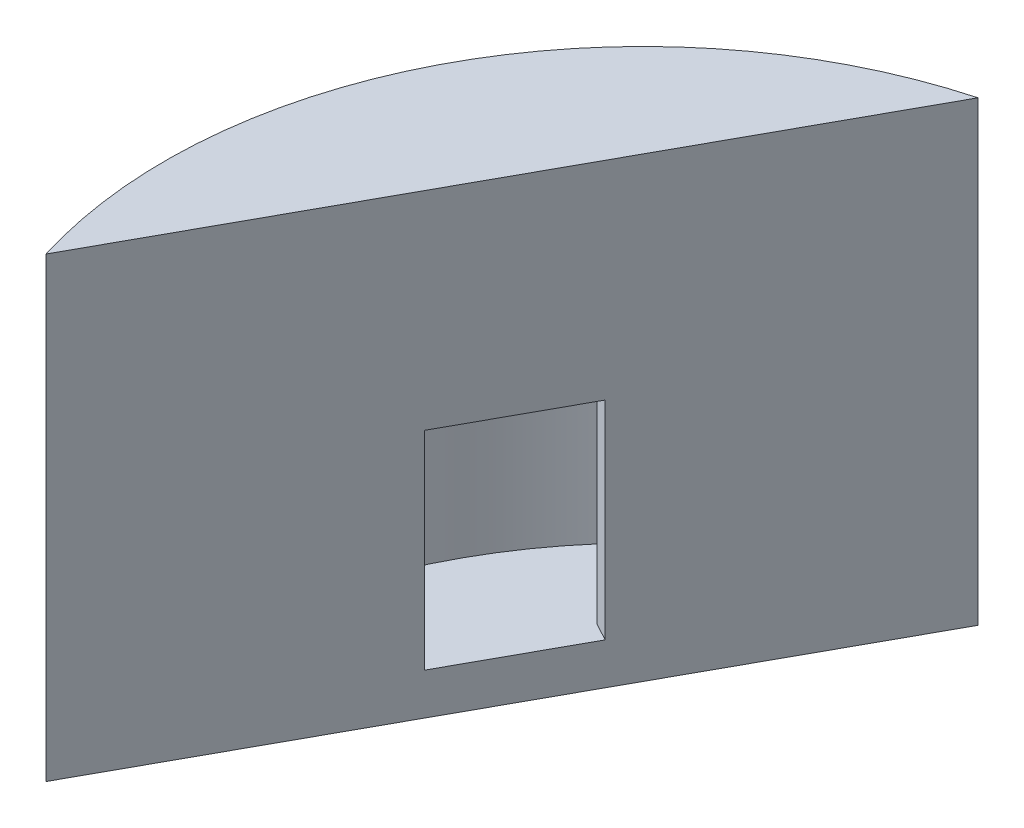
from build123d import *

# Parameters (mm, degrees)
SKETCH1_R           = 73.025
SKETCH1_R_2         = 69.85
BOSS_EXTRUDE1_DEPTH = 63.5
BOSS_EXTRUDE2_START = 6.35
SKETCH2_R           = 73.025
BOSS_EXTRUDE2_DEPTH = 6.35
BOSS_EXTRUDE3_DEPTH = 63.5
CUT_EXTRUDE2_START  = -63.5
CUT_EXTRUDE2_DEPTH  = 57.15
CUT_EXTRUDE4_START  = 19.05
SKETCH6_W           = 20.32
SKETCH6_H           = 31.75
CUT_EXTRUDE4_DEPTH  = 31.75
CUT_EXTRUDE5_DEPTH  = 1016


with BuildPart() as part:
    # Sketch1 → Boss-Extrude1 (new body)
    with BuildSketch(Plane(origin=(0, 0, 0), x_dir=(1, 0, 0), z_dir=(0, 1, 0))):
        Circle(SKETCH1_R)
        Circle(SKETCH1_R_2, mode=Mode.SUBTRACT)
    extrude(amount=BOSS_EXTRUDE1_DEPTH)

    # Sketch2 → Boss-Extrude2 (add)
    with BuildSketch(Plane.XZ.offset(BOSS_EXTRUDE2_START)):
        Circle(SKETCH2_R)
    extrude(amount=-BOSS_EXTRUDE2_DEPTH)

    # Sketch3 → Boss-Extrude3 (add)
    with BuildSketch(Plane(origin=(0, 0, 0), x_dir=(1, 0, 0), z_dir=(0, 1, 0))):
        with BuildLine():
            Line((-67.615293174, -17.526968618), (-21.409243237, 66.488095205))
            ThreePointArc((-21.409243237, 66.488095205), (-61.204368783, 33.660774529), (-67.615293174, -17.526968618))
        make_face()
    extrude(amount=BOSS_EXTRUDE3_DEPTH)

    # Sketch4 → Cut-Extrude2 (cut)
    with BuildSketch(Plane(origin=(0, 63.5, 0), x_dir=(1, 0, 0), z_dir=(0, 1, 0)).offset(CUT_EXTRUDE2_START)):
        with BuildLine():
            Line((-25.79189716, 64.913793148), (-68.632882923, -12.982676212))
            ThreePointArc((-68.632882923, -12.982676212), (-61.204368783, 33.660774529), (-25.79189716, 64.913793148))
        make_face()
    extrude(amount=CUT_EXTRUDE2_DEPTH, mode=Mode.SUBTRACT)

    # Sketch6 → Cut-Extrude4 (cut)
    with BuildSketch(Plane(origin=(-42.286654796, 0, -23.256535129), x_dir=(0.48190085223737017, 0, -0.8762257520827018), z_dir=(0.8762257520827018, 0, 0.48190085223737017)).offset(CUT_EXTRUDE4_START)):
        with Locations((0.318551336, 15.875)):
            Rectangle(SKETCH6_W, SKETCH6_H)
    extrude(amount=-CUT_EXTRUDE4_DEPTH, mode=Mode.SUBTRACT)

    # Sketch7 → Cut-Extrude5 (cut)
    with BuildSketch(Plane(origin=(0, 63.5, 0), x_dir=(1, 0, 0), z_dir=(0, 1, 0))):
        Polygon((-72.609628953, -26.608018388), (-10.171407592, 86.921512047), (114.959945388, 65.80584256), (122.548753565, -33.748740716), (41.017949176, -93.980716613), (-75.603403444, -72.676842996), align=None)
    extrude(amount=-CUT_EXTRUDE5_DEPTH, mode=Mode.SUBTRACT)


solid = part.part
